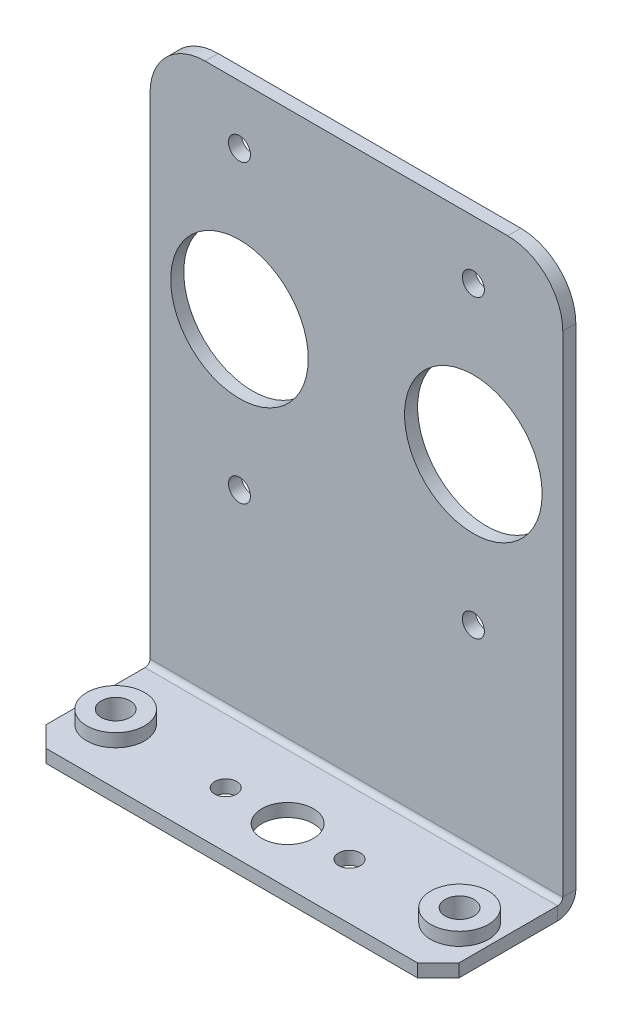
from build123d import *

# Parameters (mm, degrees)
SM_BASE_FLANGE_1_DEPTH           = 1.9
SM_EDGE_FLANGE_1_STRIP_W         = 9.0732
SM_EDGE_FLANGE_1_STRIP_H         = 1.9
SM_EDGE_FLANGE_1_STRIP_CUT_DEPTH = 60
SM_EDGE_FLANGE_1_DEPTH           = 60
CUT_EXTRUDE_1_DEPTH              = 88.336189521
SKETCH_9_R                       = 2.1
SKETCH_9_R_2                     = 1.6
SKETCH_9_R_3                     = 3.75
CUT_EXTRUDE_2_DEPTH              = 88.336189521
EXTRUDE_START                    = 1.9
SKETCH_10_R                      = 4.2
SKETCH_10_R_2                    = 2.1
EXTRUDE_2_DEPTH                  = 1.9
SKETCH_11_R                      = 1.6
SKETCH_11_R_2                    = 10
CUT_EXTRUDE_3_DEPTH              = 88.336189521


# Sheet-metal steps are written as plain solids
with BuildPart() as part:
    # Sketch 1 → 基体-法兰1 (new body)
    with BuildSketch(Plane.XY):
        with BuildLine():
            Line((-22, 80), (22, 80))
            ThreePointArc((22, 80), (27.656854249, 77.656854249), (30, 72))
            Line((30, 72), (30, 0))
            Line((30, 0), (-30, 0))
            Line((-30, 0), (-30, 72))
            ThreePointArc((-30, 72), (-27.656854249, 77.656854249), (-22, 80))
        make_face()
    extrude(amount=-SM_BASE_FLANGE_1_DEPTH)

    # 边线-法兰1 strip (across the edge) → 边线-法兰1 strip cut (cut)
    with BuildSketch(Plane.YZ.offset(-30)):
        with Locations((-3.8, -0.95)):
            Rectangle(SM_EDGE_FLANGE_1_STRIP_W, SM_EDGE_FLANGE_1_STRIP_H)
    extrude(amount=SM_EDGE_FLANGE_1_STRIP_CUT_DEPTH, mode=Mode.SUBTRACT)

    # 边线-法兰1 section (across the edge) → 边线-法兰1 (add)
    with BuildSketch(Plane.YZ.offset(-30)):
        with BuildLine():
            Line((-1.9, 0.7366), (-1.9, 18.1))
            Line((-1.9, 18.1), (0, 18.1))
            Line((0, 18.1), (0, 0.7366))
            ThreePointArc((0, 0.7366), (0.215745145, 0.215745145), (0.7366, 0))
            Line((0.7366, 0), (0.7366, -1.9))
            ThreePointArc((0.7366, -1.9), (-1.127757739, -1.127757739), (-1.9, 0.7366))
        make_face()
    extrude(amount=SM_EDGE_FLANGE_1_DEPTH)

    # 草图8 → 切除-拉伸1 (cut, through all)
    with BuildSketch(Plane(origin=(0, 0, 0), x_dir=(1, 0, 0), z_dir=(0, 1, 0))):
        Polygon((-30, -15.1), (-27, -18.1), (-30, -18.1), align=None)
        Polygon((27, -18.1), (30, -15.1), (30, -18.1), align=None)
    extrude(amount=-CUT_EXTRUDE_1_DEPTH, mode=Mode.SUBTRACT)

    # 草图9 → 切除-拉伸2 (cut, through all)
    with BuildSketch(Plane(origin=(0, 0, 0), x_dir=(1, 0, 0), z_dir=(0, 1, 0))):
        with Locations(Location((-25, -10, 0), (0, 0, 270))):
            Circle(SKETCH_9_R)
        with Locations(Location((-9, -10, 0), (0, 0, 270))):
            Circle(SKETCH_9_R_2)
        with Locations(Location((0, -10, 0), (0, 0, 270))):
            Circle(SKETCH_9_R_3)
        with Locations(Location((9, -10, 0), (0, 0, 270))):
            Circle(SKETCH_9_R_2)
        with Locations(Location((25, -10, 0), (0, 0, 270))):
            Circle(SKETCH_9_R)
    extrude(amount=-CUT_EXTRUDE_2_DEPTH, mode=Mode.SUBTRACT)

    # 草图10 → 凸台-拉伸2 (add)
    # profile 1 of 2: a face of its own
    with BuildSketch(Plane(origin=(0, 0, 0), x_dir=(1, 0, 0), z_dir=(0, 1, 0)).offset(EXTRUDE_START)):
        with Locations(Location((-25, -10, 0), (0, 0, 90))):
            Circle(SKETCH_10_R)
        with Locations(Location((-25, -10, 0), (0, 0, 270))):
            Circle(SKETCH_10_R_2, mode=Mode.SUBTRACT)
    # profile 2 of 2: a face of its own
    with BuildSketch(Plane(origin=(0, 0, 0), x_dir=(1, 0, 0), z_dir=(0, 1, 0)).offset(EXTRUDE_START)):
        with Locations(Location((25, -10, 0), (0, 0, 90))):
            Circle(SKETCH_10_R)
        with Locations(Location((25, -10, 0), (0, 0, 270))):
            Circle(SKETCH_10_R_2, mode=Mode.SUBTRACT)
    extrude(amount=-EXTRUDE_2_DEPTH)

    # 草图11 → 切除-拉伸3 (cut, through all)
    with BuildSketch(Plane.XY):
        with Locations((-17, 71.5)):
            Circle(SKETCH_11_R)
        with Locations((-17, 50)):
            Circle(SKETCH_11_R_2)
        with Locations((-17, 28.5)):
            Circle(SKETCH_11_R)
        with Locations((17, 28.5)):
            Circle(SKETCH_11_R)
        with Locations((17, 50)):
            Circle(SKETCH_11_R_2)
        with Locations((17, 71.5)):
            Circle(SKETCH_11_R)
    extrude(amount=-CUT_EXTRUDE_3_DEPTH, mode=Mode.SUBTRACT)


solid = part.part
